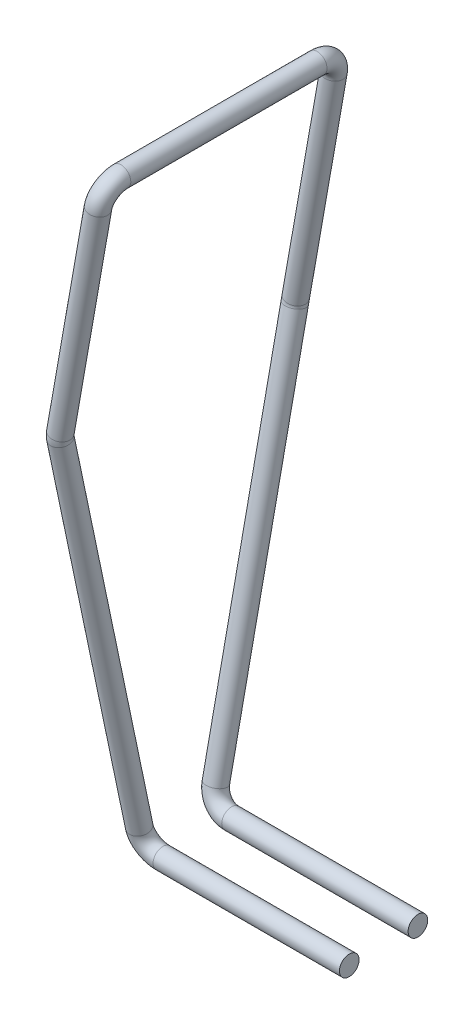
from build123d import *

# Parameters (mm, degrees)
SKETCH2_R = 0.1


with BuildPart() as part:
    # Sweep2: sweep along a curve in space
    with BuildLine() as sweep2_path:
        Line((0, 0, 0.35), (-1.9, 0, 0.35))
        ThreePointArc((-1.9, 0, 0.35), (-2.041421356, 0.05733174, 0.362022025), (-2.1, 0.195742805, 0.391045761))
        Line((-2.1, 0.195742805, 0.391045761), (-2.1, 4.026999068, 1.194430734))
        ThreePointArc((-2.1, 4.026999068, 1.194430734), (-2.098816561, 4.053599825, 1.198601334), (-2.095287734, 4.080282886, 1.2))
        Line((-2.095287734, 4.080282886, 1.2), (-1.711544882, 6.256596744, 1.2))
        ThreePointArc((-1.711544882, 6.256596744, 1.2), (-1.686987321, 6.395869592, 1.141421356), (-1.676815246, 6.453558295, 1))
        Line((-1.676815246, 6.453558295, 1), (-1.676815246, 6.453558295, -1))
        ThreePointArc((-1.711544882, 6.256596744, -1.2), (-1.686987321, 6.395869592, -1.141421356), (-1.676815246, 6.453558295, -1))
        Line((-1.711544882, 6.256596744, -1.2), (-2.095287734, 4.080282886, -1.2))
        ThreePointArc((-2.1, 4.026999068, -1.194430734), (-2.098816561, 4.053599825, -1.198601334), (-2.095287734, 4.080282886, -1.2))
        Line((-2.1, 0.195742805, -0.391045761), (-2.1, 4.026999068, -1.194430734))
        ThreePointArc((-1.9, 0, -0.35), (-2.041421356, 0.05733174, -0.362022025), (-2.1, 0.195742805, -0.391045761))
        Line((0, 0, -0.35), (-1.9, 0, -0.35))
    # Sketch2 → Sweep2 (sweep)
    with BuildSketch(Plane(origin=(0, 0, 0), x_dir=(0, 0, -1), z_dir=(1, 0, 0))):
        with Locations((-0.35, 0)):
            Circle(SKETCH2_R)
    sweep(path=sweep2_path.line)


solid = part.part
